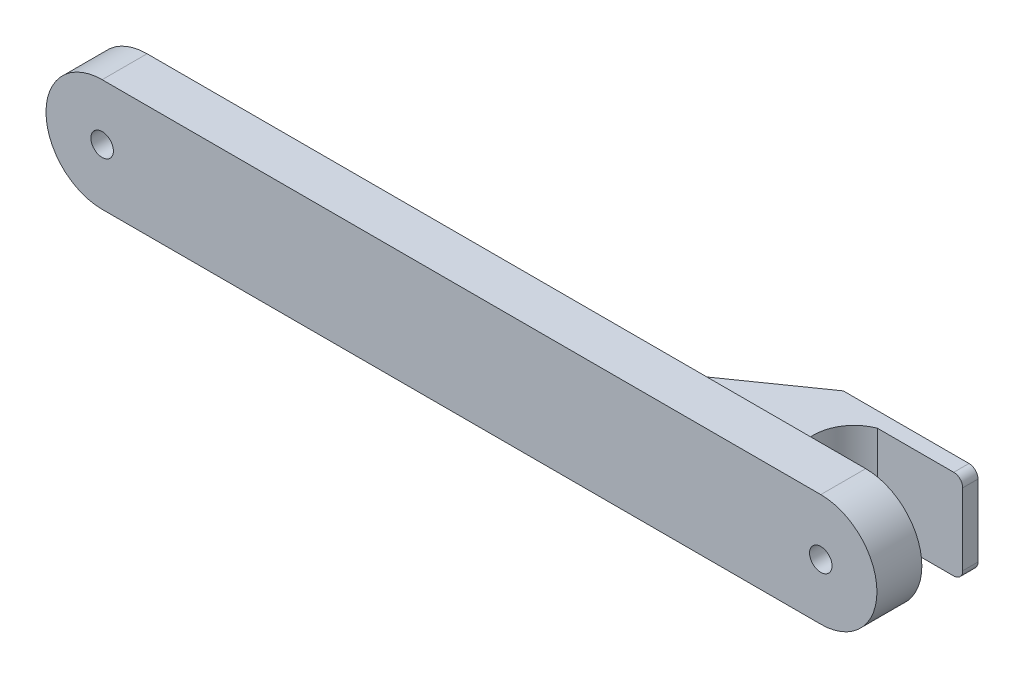
from build123d import *

# Parameters (mm, degrees)
SKETCH1_R           = 3.175
BOSS_EXTRUDE1_DEPTH = 12.7
BOSS_EXTRUDE2_DEPTH = 19.05
CUT_EXTRUDE2_DEPTH  = 30.48
BOSS_EXTRUDE7_DEPTH = 25.4


with BuildPart() as part:
    # Sketch1 → Boss-Extrude1 (new body)
    with BuildSketch(Plane.XY):
        with BuildLine():
            Line((299.870251741, -63.185614448), (503.070251741, -63.185614448))
            ThreePointArc((503.070251741, -63.185614448), (518.945251741, -79.060614448), (503.070251741, -94.935614448))
            Line((503.070251741, -94.935614448), (299.870251741, -94.935614448))
            ThreePointArc((299.870251741, -94.935614448), (283.995251741, -79.060614448), (299.870251741, -63.185614448))
        make_face()
        with Locations((299.870251741, -79.060614448)):
            Circle(SKETCH1_R, mode=Mode.SUBTRACT)
        with Locations((503.070251741, -79.060614448)):
            Circle(SKETCH1_R, mode=Mode.SUBTRACT)
    extrude(amount=BOSS_EXTRUDE1_DEPTH)

    # Sketch2 → Boss-Extrude2 (add)
    with BuildSketch(Plane(origin=(0, 0, 0), x_dir=(-1, 0, 0), z_dir=(0, 0, -1))):
        with BuildLine():
            Line((-477.670251741, -66.360614448), (-477.670251741, -91.760614448))
            Line((-477.670251741, -91.760614448), (-513.230251741, -91.760614448))
            ThreePointArc((-513.230251741, -91.760614448), (-515.026302965, -91.016665672), (-515.770251741, -89.220614448))
            Line((-515.770251741, -89.220614448), (-515.770251741, -68.900614448))
            ThreePointArc((-515.770251741, -68.900614448), (-515.026302965, -67.104563223), (-513.230251741, -66.360614448))
            Line((-513.230251741, -66.360614448), (-477.670251741, -66.360614448))
        make_face()
    extrude(amount=BOSS_EXTRUDE2_DEPTH)

    # Sketch6 → Cut-Extrude2 (cut)
    with BuildSketch(Plane.XZ.offset(91.760614448)):
        with BuildLine():
            Line((499.246061033, 0), (515.770251741, 0))
            Line((515.770251741, 0), (515.770251741, -14.733462418))
            Line((515.770251741, -14.733462418), (491.640251741, -14.733462418))
            ThreePointArc((491.640251741, -14.733462418), (485.287193282, -8.73432293), (485.036934778, 0))
            Line((485.036934778, 0), (488.908392954, 0))
            Line((488.908392954, 0), (499.246061033, 0))
        make_face()
    extrude(amount=-CUT_EXTRUDE2_DEPTH, mode=Mode.SUBTRACT)

    # Sketch4 → Boss-Extrude7 (add)
    with BuildSketch(Plane.XZ.offset(91.760614448)):
        Polygon((477.670251741, -19.05), (450.464032212, 0), (477.670251741, 0), align=None)
    extrude(amount=-BOSS_EXTRUDE7_DEPTH)


solid = part.part
